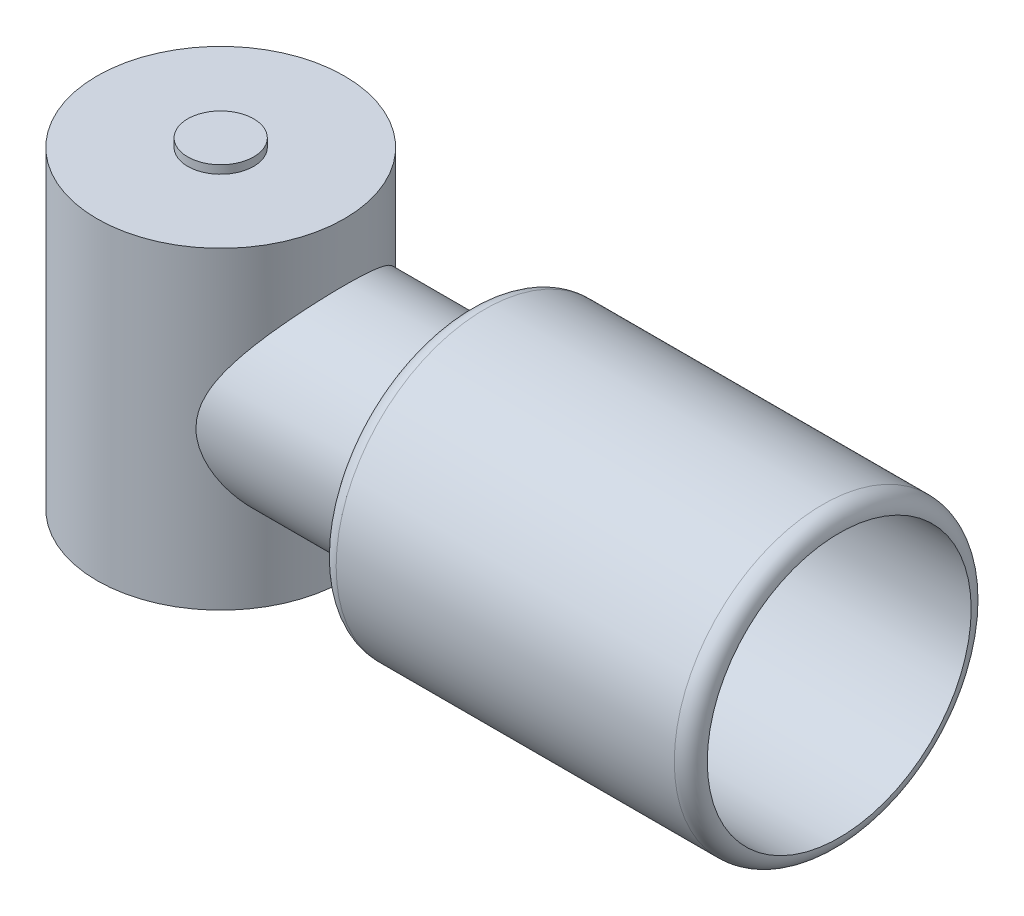
from build123d import *

# Parameters (mm, degrees)
SKETCH_2_R          = 12
EXTRUDE_1_DEPTH     = 30
SKETCH_3_R          = 18
EXTRUDE_2_DEPTH     = 45
SKETCH_4_R          = 16
CUT_EXTRUDE_1_DEPTH = 43
FILLET_1_R          = 2


with BuildPart() as part:
    # 草图1 → 旋转1 (revolve)
    with BuildSketch(Plane.XY, mode=Mode.PRIVATE) as revolve_1_sk:
        Polygon((0, 20), (-4, 20), (-4, 19), (-15, 19), (-15, 0), (0, 0), align=None)
    revolve_1 = revolve(revolve_1_sk.sketch.rotate(Axis((0, 20, 0), (0, -1, 0)), 270), axis=Axis((0, 20, 0), (0, -1, 0)))

    # 镜向1: 旋转1 across plane
    add(revolve_1.mirror(Plane(origin=(0, 0, 0), x_dir=(0, 0, 1), z_dir=(0, -1, 0))))

    # 草图2 → 凸台-拉伸1 (add)
    with BuildSketch(Plane(origin=(0, 0, 0), x_dir=(0, 0, -1), z_dir=(1, 0, 0))):
        with Locations(Location((0, 0, 0), (0, 0, 180))):
            Circle(SKETCH_2_R)
    extrude(amount=EXTRUDE_1_DEPTH)

    # 草图3 → 凸台-拉伸2 (add)
    with BuildSketch(Plane(origin=(30, 0, 0), x_dir=(0, 0, -1), z_dir=(1, 0, 0))):
        with Locations(Location((0, 0, 0), (0, 0, 180))):
            Circle(SKETCH_3_R)
    extrude(amount=EXTRUDE_2_DEPTH)

    # 草图4 → 切除-拉伸1 (cut)
    with BuildSketch(Plane(origin=(75, 0, 0), x_dir=(0, 0, -1), z_dir=(1, 0, 0))):
        Circle(SKETCH_4_R)
    extrude(amount=-CUT_EXTRUDE_1_DEPTH, mode=Mode.SUBTRACT)

    # 圆角1
    fillet_1_edges = [part.edges().sort_by_distance(p)[0] for p in [
        (30, 0, -18),
        (75, 0, -18),
    ]]
    fillet(fillet_1_edges, radius=FILLET_1_R - 0.0001)  # a hair under: the kernel refuses the full size


solid = part.part
